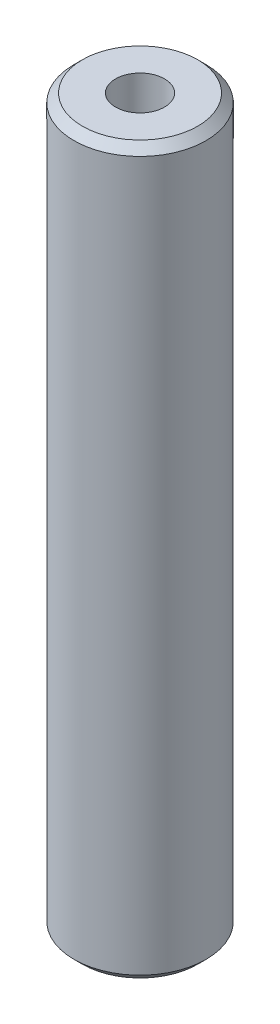
from build123d import *

# Parameters (mm, degrees)
SKETCH1_R           = 45
BOSS_EXTRUDE1_DEPTH = 494.98024334
SKETCH2_R           = 16.701595325
CUT_EXTRUDE1_DEPTH  = 500.054547417
CHAMFER1_SIZE       = 5.689196925


with BuildPart() as part:
    # Sketch1 → Boss-Extrude1 (new body)
    with BuildSketch(Plane(origin=(0, 0, 0), x_dir=(1, 0, 0), z_dir=(0, 1, 0))):
        Circle(SKETCH1_R)
    extrude(amount=BOSS_EXTRUDE1_DEPTH)

    # Sketch2 → Cut-Extrude1 (cut, through all)
    with BuildSketch(Plane(origin=(0, 0, 0), x_dir=(1, 0, 0), z_dir=(0, 1, 0))):
        Circle(SKETCH2_R)
    extrude(amount=CUT_EXTRUDE1_DEPTH, mode=Mode.SUBTRACT)

    # Chamfer1
    chamfer1_edges = [part.edges().sort_by_distance(p)[0] for p in [
        (-45, 494.98024334, 0),
        (-45, 0, 0),
    ]]
    chamfer(chamfer1_edges, length=CHAMFER1_SIZE)


solid = part.part
